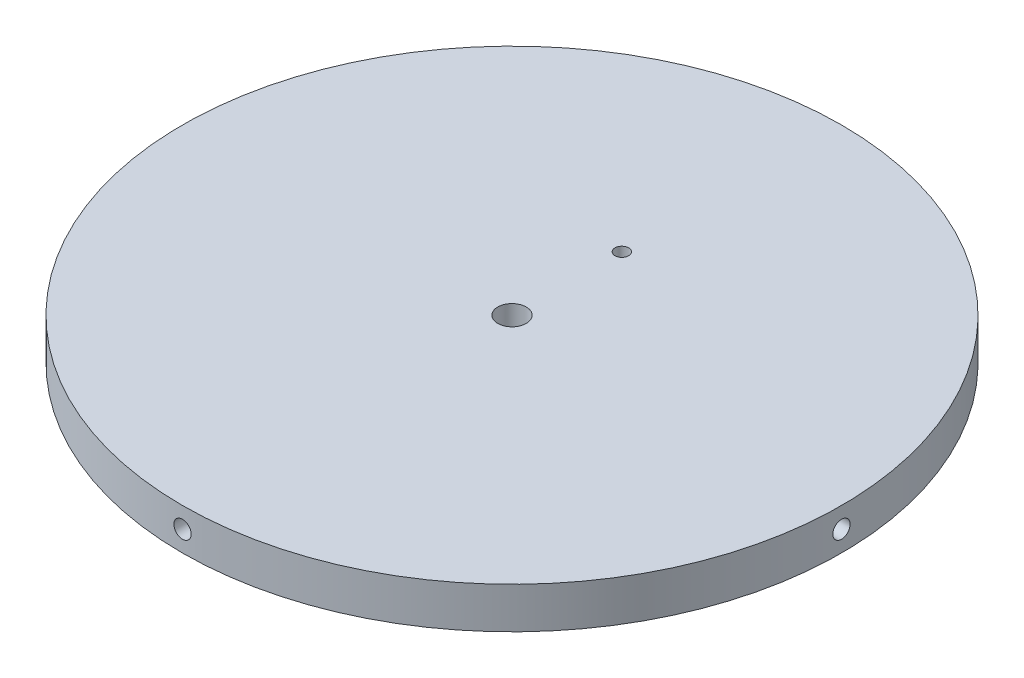
from build123d import *

# Parameters (mm, degrees)
SKETCH1_R           = 76.2
SKETCH1_R_2         = 3.3
SKETCH1_R_3         = 1.5875
BOSS_EXTRUDE1_DEPTH = 4.7625
SKETCH5_R           = 2
CUT_EXTRUDE1_DEPTH  = 19.05
CIRPATTERN5_COUNT   = 4


with BuildPart() as part:
    # Sketch1 → Boss-Extrude1 (new, symmetric)
    with BuildSketch(Plane(origin=(0, 0, 0), x_dir=(1, 0, 0), z_dir=(0, 1, 0))):
        Circle(SKETCH1_R)
        Circle(SKETCH1_R_2, mode=Mode.SUBTRACT)
        with Locations((0, 25.4)):
            Circle(SKETCH1_R_3, mode=Mode.SUBTRACT)
    extrude(amount=BOSS_EXTRUDE1_DEPTH, both=True)

    # Sketch5 → Cut-Extrude1 (cut)
    with BuildSketch(Plane.XY.offset(76.2)):
        Circle(SKETCH5_R)
    cut_extrude1 = extrude(amount=-CUT_EXTRUDE1_DEPTH, mode=Mode.SUBTRACT)

    # CirPattern5: Cut-Extrude1 ×4 about axis
    cirpattern5_axis = Axis((0, -5.272297454, 0), (0, 1, 0))
    for i in range(1, CIRPATTERN5_COUNT):
        add(cut_extrude1.rotate(cirpattern5_axis, i * 360 / CIRPATTERN5_COUNT), mode=Mode.SUBTRACT)


solid = part.part
